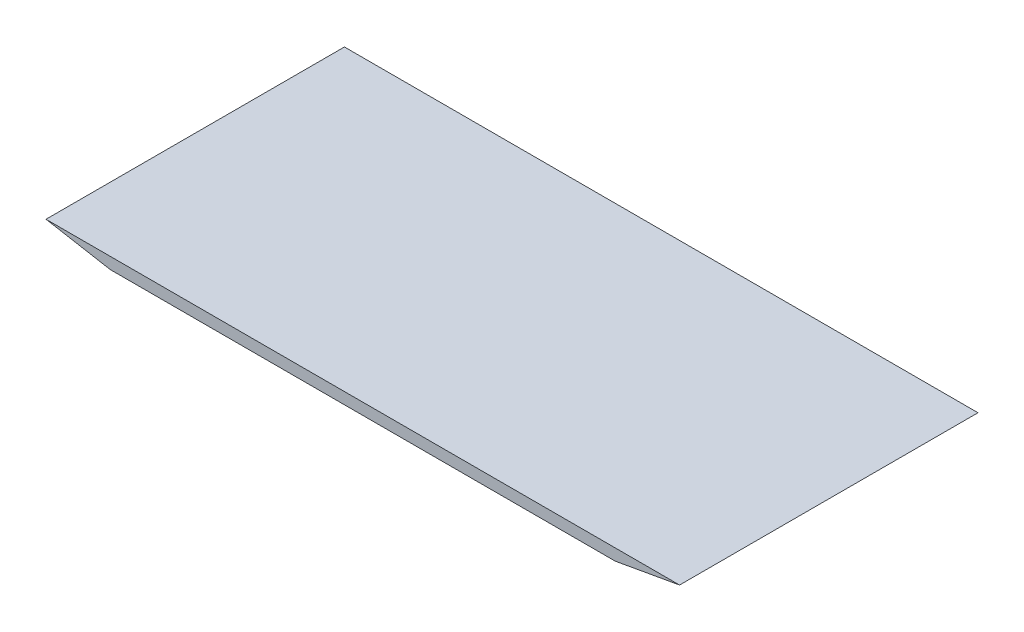
from build123d import *

# Parameters (mm, degrees)
BOSS_EXTRUDE1_DEPTH = 130


with BuildPart() as part:
    # Sketch1 → Boss-Extrude1 (new body)
    with BuildSketch(Plane.XY):
        Polygon((0, 0), (276, 0), (248, -5), (28, -5), align=None)
    extrude(amount=BOSS_EXTRUDE1_DEPTH)


solid = part.part
